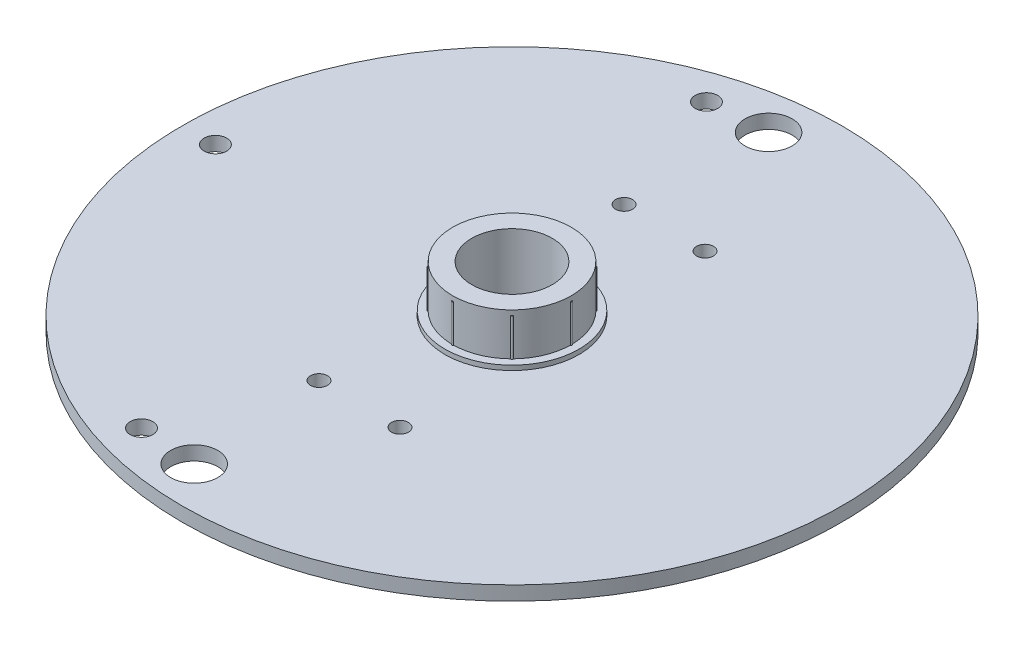
from build123d import *

# Parameters (mm, degrees)
SKETCH1_R                      = 70
BASE_PLATE_DEPTH               = 3
SKETCH2_R                      = 14.25
BEARING_STEPUP_DEPTH           = 1
SKETCH3_R                      = 12.6
BEARING_SITTING_DEPTH          = 9
SKETCH4_R                      = 0.2
BEARING_SITTING_GRID_DEPTH     = 8
SKETCH5_R                      = 2.4
M4_SCREW_CLEARANCE_HOLES_DEPTH = 100.844879688
SKETCH6_R                      = 5
HOLES_RESERVED_FOR_RODS_DEPTH  = 100.844879688
SKETCH8_R                      = 8.55
CUT_EXTRUDE1_DEPTH             = 100.844879688
CUT_EXTRUDE2_REACH             = 101.499
SKETCH9_R                      = 1.8


with BuildPart() as part:
    # Sketch1 → base-plate (new body)
    with BuildSketch(Plane(origin=(0, 0, 0), x_dir=(1, 0, 0), z_dir=(0, 1, 0))):
        Circle(SKETCH1_R)
    extrude(amount=BASE_PLATE_DEPTH)

    # Sketch2 → bearing-stepup (add)
    with BuildSketch(Plane(origin=(0, 3, 0), x_dir=(1, 0, 0), z_dir=(0, 1, 0))):
        Circle(SKETCH2_R)
    extrude(amount=BEARING_STEPUP_DEPTH)

    # Sketch3 → bearing-sitting (add)
    with BuildSketch(Plane(origin=(0, 4, 0), x_dir=(1, 0, 0), z_dir=(0, 1, 0))):
        Circle(SKETCH3_R)
    extrude(amount=BEARING_SITTING_DEPTH)

    # Sketch4 → bearing-sitting-grid (add)
    with BuildSketch(Plane(origin=(0, 4, 0), x_dir=(1, 0, 0), z_dir=(0, 1, 0))):
        with Locations((0, 12.6)):
            Circle(SKETCH4_R)
        with Locations((8.909545443, 8.909545443)):
            Circle(SKETCH4_R)
        with Locations((12.6, 0)):
            Circle(SKETCH4_R)
        with Locations((8.909545443, -8.909545443)):
            Circle(SKETCH4_R)
        with Locations((0, -12.6)):
            Circle(SKETCH4_R)
        with Locations((-8.909545443, -8.909545443)):
            Circle(SKETCH4_R)
        with Locations((-12.6, 0)):
            Circle(SKETCH4_R)
        with Locations((-8.909545443, 8.909545443)):
            Circle(SKETCH4_R)
    extrude(amount=BEARING_SITTING_GRID_DEPTH)

    # Sketch5 → m4-screw-clearance-holes (cut, through all)
    with BuildSketch(Plane.XZ):
        with Locations((-18.7, 60)):
            Circle(SKETCH5_R)
        with Locations((-63, 0)):
            Circle(SKETCH5_R)
        with Locations((-18.7, -60)):
            Circle(SKETCH5_R)
    extrude(amount=-M4_SCREW_CLEARANCE_HOLES_DEPTH, mode=Mode.SUBTRACT)

    # Sketch6 → holes-reserved-for-rods (cut, through all)
    with BuildSketch(Plane.XZ):
        with Locations((-6.5, 61)):
            Circle(SKETCH6_R)
        with Locations((-6.5, -61)):
            Circle(SKETCH6_R)
    extrude(amount=-HOLES_RESERVED_FOR_RODS_DEPTH, mode=Mode.SUBTRACT)

    # Sketch8 → Cut-Extrude1 (cut, through all)
    with BuildSketch(Plane(origin=(0, 13, 0), x_dir=(1, 0, 0), z_dir=(0, 1, 0))):
        Circle(SKETCH8_R)
    extrude(amount=-CUT_EXTRUDE1_DEPTH, mode=Mode.SUBTRACT)

    # Sketch9 → Cut-Extrude2 (cut, up to next)
    with BuildSketch(Plane(origin=(0, 3, 0), x_dir=(1, 0, 0), z_dir=(0, 1, 0)), mode=Mode.PRIVATE) as cut_extrude2_sk1:
        with Locations((-8.6, 32.4)):
            Circle(SKETCH9_R)
    cut_extrude2_tool1 = extrude(cut_extrude2_sk1.sketch, amount=-CUT_EXTRUDE2_REACH, mode=Mode.PRIVATE) & part.part
    # Sketch9 → Cut-Extrude2 (cut, up to next)
    with BuildSketch(Plane(origin=(0, 3, 0), x_dir=(1, 0, 0), z_dir=(0, 1, 0)), mode=Mode.PRIVATE) as cut_extrude2_sk2:
        with Locations((8.6, 32.4)):
            Circle(SKETCH9_R)
    cut_extrude2_tool2 = extrude(cut_extrude2_sk2.sketch, amount=-CUT_EXTRUDE2_REACH, mode=Mode.PRIVATE) & part.part
    # Sketch9 → Cut-Extrude2 (cut, up to next)
    with BuildSketch(Plane(origin=(0, 3, 0), x_dir=(1, 0, 0), z_dir=(0, 1, 0)), mode=Mode.PRIVATE) as cut_extrude2_sk3:
        with Locations((8.6, -32.4)):
            Circle(SKETCH9_R)
    cut_extrude2_tool3 = extrude(cut_extrude2_sk3.sketch, amount=-CUT_EXTRUDE2_REACH, mode=Mode.PRIVATE) & part.part
    # Sketch9 → Cut-Extrude2 (cut, up to next)
    with BuildSketch(Plane(origin=(0, 3, 0), x_dir=(1, 0, 0), z_dir=(0, 1, 0)), mode=Mode.PRIVATE) as cut_extrude2_sk4:
        with Locations((-8.6, -32.4)):
            Circle(SKETCH9_R)
    cut_extrude2_tool4 = extrude(cut_extrude2_sk4.sketch, amount=-CUT_EXTRUDE2_REACH, mode=Mode.PRIVATE) & part.part
    add(cut_extrude2_tool1.solids().sort_by_distance((-8.6, 3, -32.4))[0], mode=Mode.SUBTRACT)
    add(cut_extrude2_tool2.solids().sort_by_distance((8.6, 3, -32.4))[0], mode=Mode.SUBTRACT)
    add(cut_extrude2_tool3.solids().sort_by_distance((8.6, 3, 32.4))[0], mode=Mode.SUBTRACT)
    add(cut_extrude2_tool4.solids().sort_by_distance((-8.6, 3, 32.4))[0], mode=Mode.SUBTRACT)


solid = part.part
